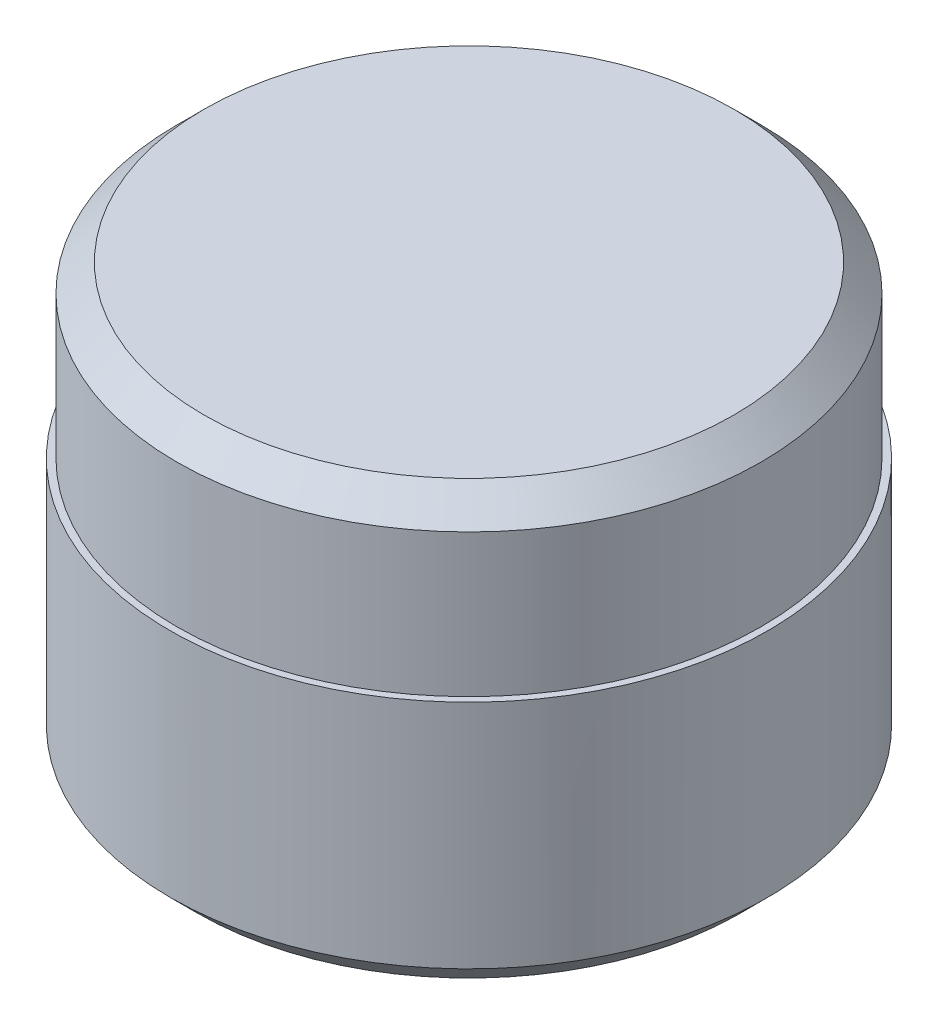
from build123d import *

# Parameters (mm, degrees)
SKETCH1_R           = 4.4
BOSS_EXTRUDE1_DEPTH = 3.8
SKETCH2_R           = 4.3
BOSS_EXTRUDE2_DEPTH = 2.5
CHAMFER1_SIZE       = 0.4


with BuildPart() as part:
    # Sketch1 → Boss-Extrude1 (new body)
    with BuildSketch(Plane(origin=(0, 0, 0), x_dir=(1, 0, 0), z_dir=(0, 1, 0))):
        Circle(SKETCH1_R)
    extrude(amount=BOSS_EXTRUDE1_DEPTH)

    # Sketch2 → Boss-Extrude2 (add)
    with BuildSketch(Plane(origin=(0, 3.8, 0), x_dir=(1, 0, 0), z_dir=(0, 1, 0))):
        Circle(SKETCH2_R)
    extrude(amount=BOSS_EXTRUDE2_DEPTH)

    # Chamfer1
    chamfer1_edges = [part.edges().sort_by_distance(p)[0] for p in [
        (-4.4, 0, 0),
        (-4.3, 6.3, 0),
    ]]
    chamfer(chamfer1_edges, length=CHAMFER1_SIZE)


solid = part.part
